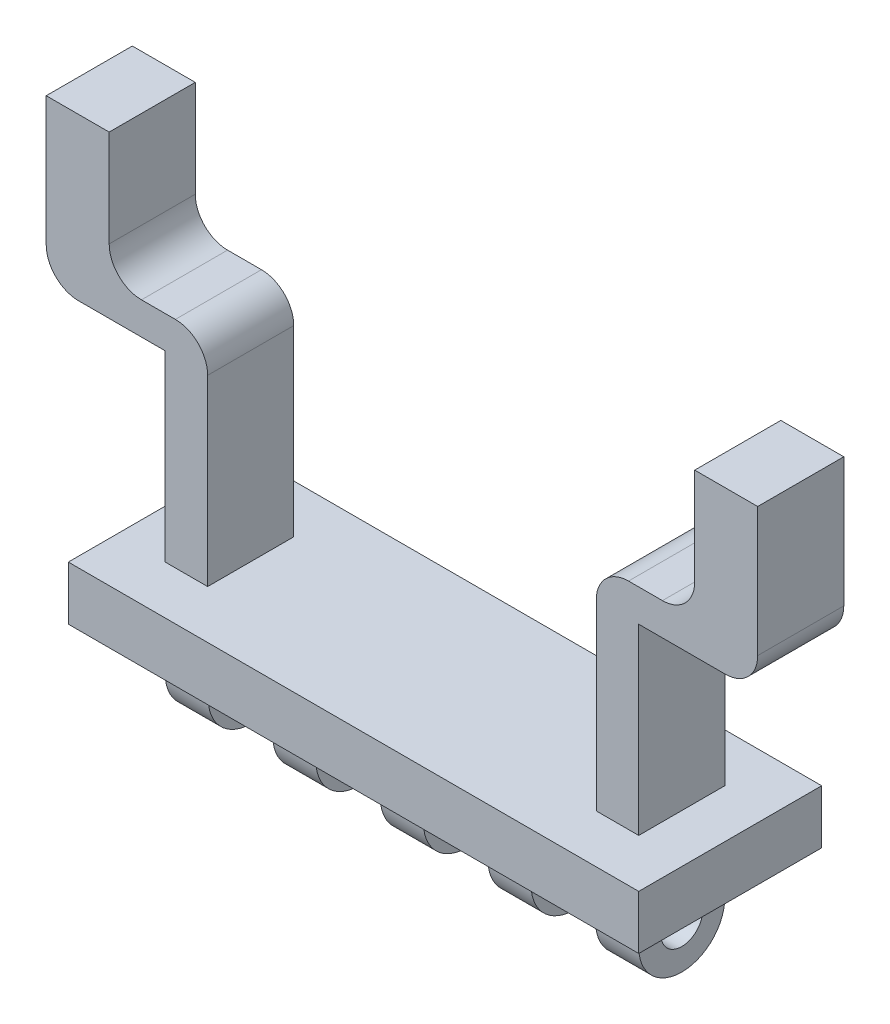
from build123d import *

# Parameters (mm, degrees)
SKETCH1_W              = 44
SKETCH1_H              = 8
BOSS_EXTRUDE1_DEPTH    = 5
SKETCH2_W              = 3.945665761
SKETCH2_H              = 8
BOSS_EXTRUDE2_DEPTH    = 17
SKETCH3_W              = 8
SKETCH3_H              = 3
BOSS_EXTRUDE3_DEPTH    = 15
SKETCH4_W              = 5.850643969
SKETCH4_H              = 8
BOSS_EXTRUDE4_DEPTH    = 12
SKETCH5_W              = 4
SKETCH5_H              = 8
BOSS_EXTRUDE5_DEPTH    = 8
FILLET2_R              = 4
LPATTERN1_COUNT        = 5
LPATTERN1_PITCH        = 10
FILLET2_OF_LPATTERN1_R = 4
SKETCH6_R              = 1.941337646
CUT_EXTRUDE1_DEPTH     = 67.452838302
SKETCH7_W              = 44
SKETCH7_H              = 5
BOSS_EXTRUDE6_DEPTH    = 4.5
SKETCH8_W              = 12.5
SKETCH8_H              = 5
BOSS_EXTRUDE7_DEPTH    = 4.5
SKETCH9_W              = 48.5
SKETCH9_H              = 5
BOSS_EXTRUDE8_DEPTH    = 4.5
SKETCH10_W             = 17
SKETCH10_H             = 5
BOSS_EXTRUDE9_DEPTH    = 4.5
FILLET4_R              = 3


with BuildPart() as part:
    # Sketch1 → Boss-Extrude1 (new body)
    with BuildSketch(Plane(origin=(0, 0, 0), x_dir=(1, 0, 0), z_dir=(0, 1, 0))):
        Rectangle(SKETCH1_W, SKETCH1_H)
    extrude(amount=BOSS_EXTRUDE1_DEPTH)

    # Sketch2 → Boss-Extrude2 (add)
    with BuildSketch(Plane(origin=(0, 5, 0), x_dir=(1, 0, 0), z_dir=(0, 1, 0))):
        with Locations((20.027167119, 0)):
            Rectangle(SKETCH2_W, SKETCH2_H)
    boss_extrude2 = extrude(amount=BOSS_EXTRUDE2_DEPTH)

    # Sketch3 → Boss-Extrude3 (add)
    with BuildSketch(Plane.ZY.offset(-18.054334239)):
        with Locations((0, 23.5)):
            Rectangle(SKETCH3_W, SKETCH3_H)
    boss_extrude3 = extrude(amount=-BOSS_EXTRUDE3_DEPTH)

    # Sketch4 → Boss-Extrude4 (add)
    with BuildSketch(Plane(origin=(0, 25, 0), x_dir=(1, 0, 0), z_dir=(0, 1, 0))):
        with Locations((30.129012255, 0)):
            Rectangle(SKETCH4_W, SKETCH4_H)
    boss_extrude4 = extrude(amount=BOSS_EXTRUDE4_DEPTH)

    # Mirror1: Boss-Extrude2, Boss-Extrude3, Boss-Extrude4 across plane
    add(boss_extrude2.mirror(Plane(origin=(0, 0, 0), x_dir=(0, 0, 1), z_dir=(1, 0, 0))))
    add(boss_extrude3.mirror(Plane(origin=(0, 0, 0), x_dir=(0, 0, 1), z_dir=(1, 0, 0))))
    add(boss_extrude4.mirror(Plane(origin=(0, 0, 0), x_dir=(0, 0, 1), z_dir=(1, 0, 0))))

    # Sketch5 → Boss-Extrude5 (add)
    with BuildSketch(Plane.XZ):
        with Locations((20, 0)):
            Rectangle(SKETCH5_W, SKETCH5_H)
    boss_extrude5 = extrude(amount=BOSS_EXTRUDE5_DEPTH)

    # Fillet2
    fillet2_edges = [part.edges().sort_by_distance(p)[0] for p in [
        (20, -8, -4),
        (20, -8, 4),
    ]]
    fillet(fillet2_edges, radius=FILLET2_R - 0.0001)  # a hair under: the kernel refuses the full size

    # LPattern1: Boss-Extrude5 ×5
    with Locations(*[(-i * LPATTERN1_PITCH, 0, 0) for i in range(1, LPATTERN1_COUNT)]):
        add(boss_extrude5)

    # Fillet2 of LPattern1
    fillet2_of_lpattern1_edges = [part.edges().sort_by_distance(p)[0] for p in [
        (10, -8, -4),
        (10, -8, 4),
        (0, -8, -4),
        (0, -8, 4),
        (-10, -8, -4),
        (-10, -8, 4),
        (-20, -8, -4),
        (-20, -8, 4),
    ]]
    fillet(fillet2_of_lpattern1_edges, radius=FILLET2_OF_LPATTERN1_R - 0.0001)  # a hair under: the kernel refuses the full size

    # Sketch6 → Cut-Extrude1 (cut, through all)
    with BuildSketch(Plane(origin=(22, 0, 0), x_dir=(0, 0, -1), z_dir=(1, 0, 0))):
        with Locations((0, -4)):
            Circle(SKETCH6_R)
    extrude(amount=-CUT_EXTRUDE1_DEPTH, mode=Mode.SUBTRACT)

    # Sketch7 → Boss-Extrude6 (add)
    with BuildSketch(Plane.XY.offset(4)):
        with Locations((0, 2.5)):
            Rectangle(SKETCH7_W, SKETCH7_H)
    extrude(amount=BOSS_EXTRUDE6_DEPTH)

    # Sketch8 → Boss-Extrude7 (add)
    with BuildSketch(Plane.ZY.offset(22)):
        with Locations((2.25, 2.5)):
            Rectangle(SKETCH8_W, SKETCH8_H)
    extrude(amount=BOSS_EXTRUDE7_DEPTH)

    # Sketch9 → Boss-Extrude8 (add)
    with BuildSketch(Plane(origin=(0, 0, -4), x_dir=(-1, 0, 0), z_dir=(0, 0, -1))):
        with Locations((2.25, 2.5)):
            Rectangle(SKETCH9_W, SKETCH9_H)
    extrude(amount=BOSS_EXTRUDE8_DEPTH)

    # Sketch10 → Boss-Extrude9 (add)
    with BuildSketch(Plane(origin=(22, 0, 0), x_dir=(0, 0, -1), z_dir=(1, 0, 0))):
        with Locations((0, 2.5)):
            Rectangle(SKETCH10_W, SKETCH10_H)
    extrude(amount=BOSS_EXTRUDE9_DEPTH)

    # Fillet4
    fillet4_edges = [part.edges().sort_by_distance(p)[0] for p in [
        (33.054334239, 22, 0),
        (18.054334239, 25, 0),
        (27.20369027, 25, 0),
        (-18.054334239, 25, 0),
        (-33.054334239, 22, 0),
        (-27.20369027, 25, 0),
    ]]
    fillet(fillet4_edges, radius=FILLET4_R)


solid = part.part
